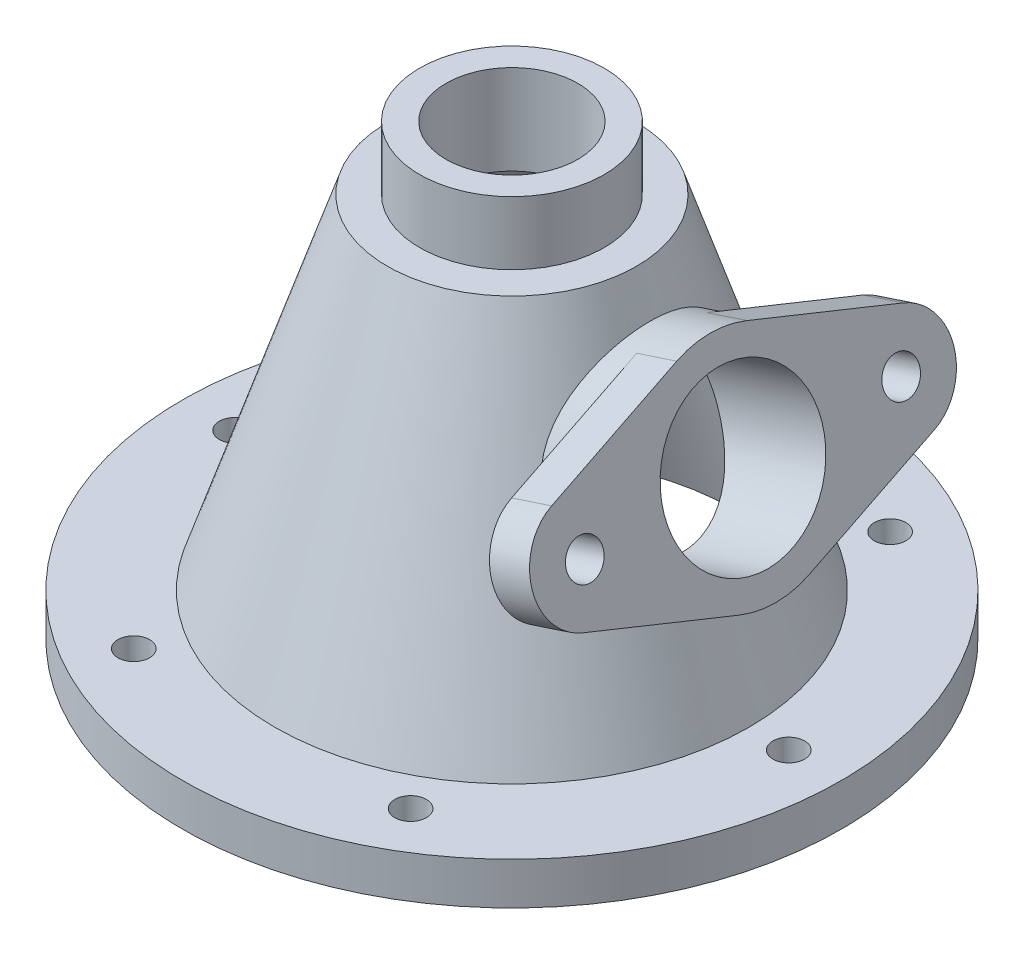
from build123d import *

# Parameters (mm, degrees)
SKETCH_4_W              = 17.5
SKETCH_4_H              = 11.999999999999986
SHELL_START             = 68
SHELL_1_OUTLINE_R       = 12.5
SHELL_1_DEPTH           = 17
EXTRUDE_2_REACH         = 143.612
SKETCH_7_R              = 19.99999999999999
SKETCH_8_R              = 3.500000000000001
EXTRUDE_3_DEPTH         = 8
CUT_EXTRUDE_START       = -21.159422762
CUT_EXTRUDE_1_OUTLINE_R = 15
CUT_EXTRUDE_1_DEPTH     = 21.159422762
CUT_EXTRUDE_2_REACH     = 119.224
SKETCH_9_R              = 3.0000000000000013
SKETCH_9_R_2            = 3.0000000000000018
SKETCH_9_R_3            = 2.9999999999999987
SKETCH_9_R_4            = 2.999999999999999


# Read off the part's stored shape, not the designer's step: 抽壳1, 切除-拉伸1
with BuildPart() as part:
    # 草图4 → 旋转1 (revolve)
    with BuildSketch(Plane.XY, mode=Mode.PRIVATE) as revolve_1_sk:
        with Locations((-8.75, 79)):
            Rectangle(SKETCH_4_W, SKETCH_4_H)
        Polygon((-62.5, 8), (-62.5, 0), (-42.367966888227485, 0), (-19.99999999999999, 67.99999999999997), (0, 67.99999999999997), (0, 73.00000000000001), (-17.5, 73.00000000000001), (-23.618855180370783, 73.00000000000001), (-45, 8), align=None)
    revolve(revolve_1_sk.sketch.rotate(Axis((0, 0, 0), (0, 1, 0)), 270), axis=Axis((0, 0, 0), (0, 1, 0)))

    # 抽壳1 outline → 抽壳1 (cut)
    with BuildSketch(Plane(origin=(0, 0, 0), x_dir=(1, 0, 0), z_dir=(0, 1, 0)).offset(SHELL_START)):
        Circle(SHELL_1_OUTLINE_R)
    extrude(amount=SHELL_1_DEPTH, mode=Mode.SUBTRACT)

    # 草图7 → 凸台-拉伸2 (add, up to next)
    with BuildSketch(Plane(origin=(42.98090645471225, 14.138169005955993, 0), x_dir=(0, 0, 1), z_dir=(-0.9499276731466783, -0.31246986381111624, 0)), mode=Mode.PRIVATE) as extrude_2_sk1:
        with Locations(Location((0, 33.804881714770495, 0), (0, 0, 90))):
            Circle(SKETCH_7_R)
    extrude_2_tool1 = extrude(extrude_2_sk1.sketch, amount=EXTRUDE_2_REACH, mode=Mode.PRIVATE) - part.part


with BuildPart() as body_2:
    # 草图6 → 旋转2 (revolve)
    with BuildSketch(Plane.XY):
        Polygon((32.417899669147, 46.25036163426662), (26.1685023929247, 65.24891509720017), (37.56763447068482, 68.99855346293356), (43.81703174690713, 50), align=None)
    revolve(axis=Axis((50.865675487969646, 52.31858573245586, 0), (-0.9499276731466784, -0.31246986381111624, 0)))


with BuildPart() as part_1:
    add(part.part)

    add(body_2.part)  # 凸台-拉伸2 merges body 2
    add(extrude_2_tool1.solids().sort_by_distance((32.4179, 46.250362, 0))[0])
    add(extrude_2_tool1.solids().sort_by_distance((32.4179, 46.250362, 0))[1])

    # 草图8 → 凸台-拉伸3 (add)
    # profile 1 of 2: a face of its own
    with BuildSketch(Plane(origin=(54.38003853247239, 17.88780737168939, 0), x_dir=(0, 0, -1), z_dir=(0.9499276731466783, 0.31246986381111624, 0))):
        with BuildLine():
            ThreePointArc((33.3333333333333, 24.37679227788569), (39.999999077050425, 33.804881714770474), (33.3333333333333, 43.23297115165526))
            Line((33.3333333333333, 43.23297115165526), (6.666667281966372, 52.66106232887043))
            ThreePointArc((6.666667281966377, 52.66106232887044), (16.329931806950803, 45.35188683213041), (19.99999999999999, 33.804881714770495))
            ThreePointArc((19.99999999999999, 33.80488171477049), (16.329931806950796, 22.257876597410572), (6.666667281966361, 14.948701100670544))
            Line((6.666667281966372, 14.948701100670537), (33.3333333333333, 24.376792277885695))
        make_face()
        with Locations(Location((30, 33.80488171477048, 0), (0, 0, 90))):
            Circle(SKETCH_8_R, mode=Mode.SUBTRACT)
    # profile 2 of 2: a face of its own
    with BuildSketch(Plane(origin=(54.38003853247239, 17.88780737168939, 0), x_dir=(0, 0, -1), z_dir=(0.9499276731466783, 0.31246986381111624, 0))):
        with BuildLine():
            ThreePointArc((-6.666667281966367, 14.948701100670544), (-19.99999999999999, 33.804881714770495), (-6.666667281966375, 52.66106232887044))
            Line((-6.666667281966372, 52.66106232887043), (-33.3333333333333, 43.23297115165526))
            ThreePointArc((-33.3333333333333, 43.23297115165526), (-39.999999077050425, 33.804881714770474), (-33.3333333333333, 24.37679227788569))
            Line((-33.3333333333333, 24.376792277885695), (-6.666667281966372, 14.948701100670537))
        make_face()
        with Locations(Location((-30, 33.80488171477048, 0), (0, 0, 90))):
            Circle(SKETCH_8_R, mode=Mode.SUBTRACT)
    extrude(amount=-EXTRUDE_3_DEPTH)

    # 切除-拉伸1 outline → 切除-拉伸1 (cut)
    with BuildSketch(Plane(origin=(54.38003853247239, 17.88780737168939, 0), x_dir=(0, 0, -1), z_dir=(0.9499276731466783, 0.31246986381111624, 0)).offset(CUT_EXTRUDE_START)):
        with Locations((0, 33.804881715)):
            Circle(CUT_EXTRUDE_1_OUTLINE_R)
    extrude(amount=CUT_EXTRUDE_1_DEPTH, mode=Mode.SUBTRACT)

    # 草图9 → 切除-拉伸2 (cut, up to next)
    with BuildSketch(Plane(origin=(0, 8, 0), x_dir=(1, 0, 0), z_dir=(0, 1, 0)), mode=Mode.PRIVATE) as cut_extrude_2_sk1:
        with Locations(Location((-52.5, 0, 0), (0, 0, 270))):
            Circle(SKETCH_9_R)
    cut_extrude_2_tool1 = extrude(cut_extrude_2_sk1.sketch, amount=-CUT_EXTRUDE_2_REACH, mode=Mode.PRIVATE) & part_1.part
    # 草图9 → 切除-拉伸2 (cut, up to next)
    with BuildSketch(Plane(origin=(0, 8, 0), x_dir=(1, 0, 0), z_dir=(0, 1, 0)), mode=Mode.PRIVATE) as cut_extrude_2_sk2:
        with Locations(Location((-26.249999999999893, 45.46633369868309, 0), (0, 0, 270))):
            Circle(SKETCH_9_R_2)
    cut_extrude_2_tool2 = extrude(cut_extrude_2_sk2.sketch, amount=-CUT_EXTRUDE_2_REACH, mode=Mode.PRIVATE) & part_1.part
    # 草图9 → 切除-拉伸2 (cut, up to next)
    with BuildSketch(Plane(origin=(0, 8, 0), x_dir=(1, 0, 0), z_dir=(0, 1, 0)), mode=Mode.PRIVATE) as cut_extrude_2_sk3:
        with Locations(Location((26.25000000000021, 45.46633369868293, 0), (0, 0, 270))):
            Circle(SKETCH_9_R)
    cut_extrude_2_tool3 = extrude(cut_extrude_2_sk3.sketch, amount=-CUT_EXTRUDE_2_REACH, mode=Mode.PRIVATE) & part_1.part
    # 草图9 → 切除-拉伸2 (cut, up to next)
    with BuildSketch(Plane(origin=(0, 8, 0), x_dir=(1, 0, 0), z_dir=(0, 1, 0)), mode=Mode.PRIVATE) as cut_extrude_2_sk4:
        with Locations(Location((52.5, -3.6661e-13, 0), (0, 0, 270))):
            Circle(SKETCH_9_R_2)
    cut_extrude_2_tool4 = extrude(cut_extrude_2_sk4.sketch, amount=-CUT_EXTRUDE_2_REACH, mode=Mode.PRIVATE) & part_1.part
    # 草图9 → 切除-拉伸2 (cut, up to next)
    with BuildSketch(Plane(origin=(0, 8, 0), x_dir=(1, 0, 0), z_dir=(0, 1, 0)), mode=Mode.PRIVATE) as cut_extrude_2_sk5:
        with Locations(Location((26.249999999999574, -45.46633369868327, 0), (0, 0, 270))):
            Circle(SKETCH_9_R_3)
    cut_extrude_2_tool5 = extrude(cut_extrude_2_sk5.sketch, amount=-CUT_EXTRUDE_2_REACH, mode=Mode.PRIVATE) & part_1.part
    # 草图9 → 切除-拉伸2 (cut, up to next)
    with BuildSketch(Plane(origin=(0, 8, 0), x_dir=(1, 0, 0), z_dir=(0, 1, 0)), mode=Mode.PRIVATE) as cut_extrude_2_sk6:
        with Locations(Location((-26.25000000000053, -45.46633369868272, 0), (0, 0, 270))):
            Circle(SKETCH_9_R_4)
    cut_extrude_2_tool6 = extrude(cut_extrude_2_sk6.sketch, amount=-CUT_EXTRUDE_2_REACH, mode=Mode.PRIVATE) & part_1.part
    add(cut_extrude_2_tool1.solids().sort_by_distance((-52.5, 8, 0))[0], mode=Mode.SUBTRACT)
    add(cut_extrude_2_tool2.solids().sort_by_distance((-26.25, 8, -45.466334))[0], mode=Mode.SUBTRACT)
    add(cut_extrude_2_tool3.solids().sort_by_distance((26.25, 8, -45.466334))[0], mode=Mode.SUBTRACT)
    add(cut_extrude_2_tool4.solids().sort_by_distance((52.5, 8, 0))[0], mode=Mode.SUBTRACT)
    add(cut_extrude_2_tool5.solids().sort_by_distance((26.25, 8, 45.466334))[0], mode=Mode.SUBTRACT)
    add(cut_extrude_2_tool6.solids().sort_by_distance((-26.25, 8, 45.466334))[0], mode=Mode.SUBTRACT)


solid = part_1.part
